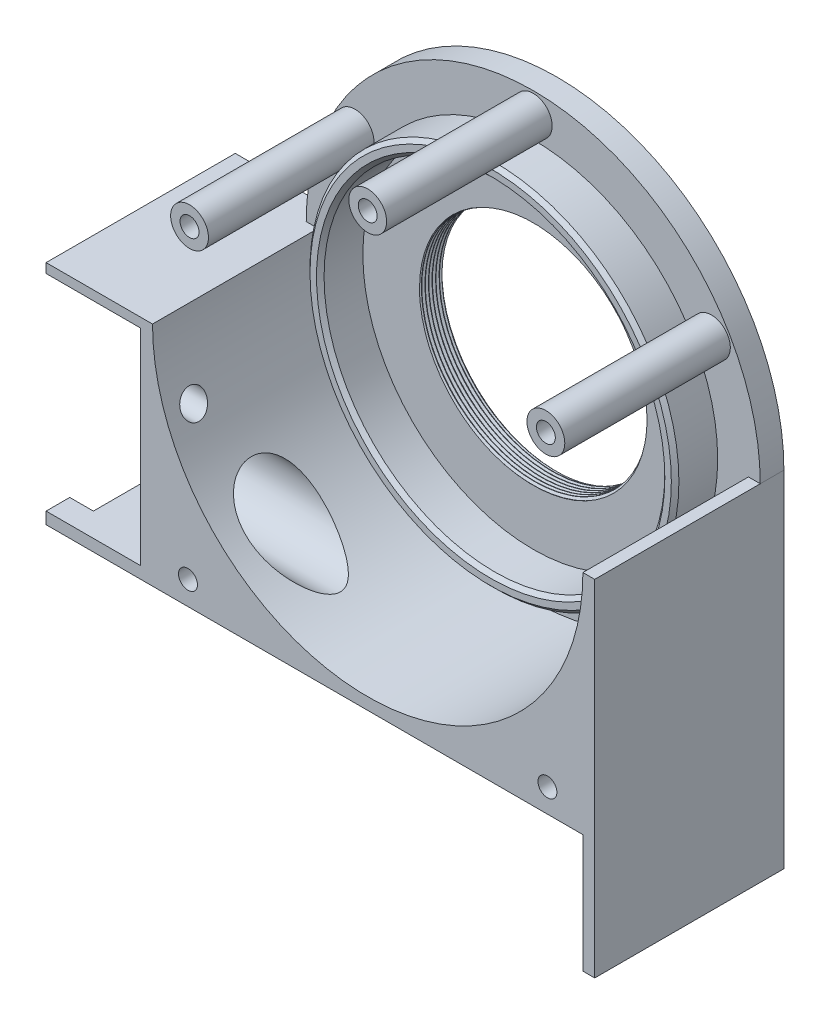
from build123d import *

# Parameters (mm, degrees)
ESQUISSE1_R                           = 48
ESQUISSE1_R_2                         = 23.8
BOSS_EXTRU_1_DEPTH                    = 40
ESQUISSE2_R                           = 45.5
ENL_V_MAT_EXTRU_1_DEPTH               = 35
CHANFREIN2_SIZE                       = 0.5
ENL_VEMENT_DE_MATI_RE_BALAYAGE1_PITCH = 0.75
ENL_V_MAT_EXTRU_6_DEPTH               = 35
ESQUISSE27_R                          = 7.675
ENL_V_MAT_EXTRU_7_DEPTH               = 79.790862536
BOSS_EXTRU_5_REACH                    = 116.543
BOSS_EXTRU_5_END_RADIUS               = 48
ESQUISSE33_W                          = 40
ESQUISSE33_H                          = 48
ESQUISSE33_R                          = 7.675
ESQUISSE33_R_2                        = 2.75
ESQUISSE35_R                          = 2.75
ENL_V_MAT_EXTRU_12_DEPTH              = 16
BOSS_EXTRU_6_DEPTH                    = 20
ESQUISSE37_W                          = 68
ESQUISSE37_H                          = 2.5
BOSS_EXTRU_7_DEPTH                    = 25
BOSS_EXTRU_10_REACH                   = 109.485
BOSS_EXTRU_11_DEPTH                   = 25
ESQUISSE46_R                          = 2
ENL_V_MAT_EXTRU_14_DEPTH              = 5
ESQUISSE47_R                          = 39
ESQUISSE47_R_2                        = 36.025
BOSS_EXTRU_12_DEPTH                   = 9
ESQUISSE48_W                          = 10
ESQUISSE48_H                          = 27.5
ENL_V_MAT_EXTRU_15_DEPTH              = 9
CHANFREIN3_SIZE                       = 0.8
ESQUISSE49_R                          = 4
ESQUISSE49_R_2                        = 2
BOSS_EXTRU_13_DEPTH                   = 35
ESQUISSE50_W                          = 37.5
ESQUISSE50_H                          = 2
BOSS_EXTRU_14_DEPTH                   = 20


with BuildPart() as part:
    # Esquisse1 → Boss.-Extru.1 (new body)
    with BuildSketch(Plane.XY):
        Circle(ESQUISSE1_R)
        Circle(ESQUISSE1_R_2, mode=Mode.SUBTRACT)
    extrude(amount=BOSS_EXTRU_1_DEPTH)

    # Esquisse2 → Enlèv. mat.-Extru.1 (cut)
    with BuildSketch(Plane.XY.offset(40)):
        Circle(ESQUISSE2_R)
    extrude(amount=-ENL_V_MAT_EXTRU_1_DEPTH, mode=Mode.SUBTRACT)

    # Chanfrein2
    chanfrein2_edges = [part.edges().sort_by_distance(p)[0] for p in [
        (-23.8, 0, 0),
    ]]
    chamfer(chanfrein2_edges, length=CHANFREIN2_SIZE)

    # Enlèvement de matière-Balayage1: arcs per turn and ends read off the stored shape
    # Enlèvement de matière-Balayage1: the profile of Esquisse15 profile screwed along a left-hand helix through 10 turns, 8 arcs to a turn; built about Z, then put on its axis
    enl_vement_de_mati_re_balayage1_z = Axis((0, 0, 0), (0, 0, 1))
    enl_vement_de_mati_re_balayage1_corners = [(23.7997, 1.2461e-05, 0.644965711), (23.7997, 1.2461e-05, -0.017880699), (24.297964607, 1.2722e-05, 0.269792506), (24.297964607, 1.2722e-05, 0.357292506)]
    with BuildLine(mode=Mode.PRIVATE) as enl_vement_de_mati_re_balayage1_profile:
        Line(enl_vement_de_mati_re_balayage1_corners[0], enl_vement_de_mati_re_balayage1_corners[1])
        Line(enl_vement_de_mati_re_balayage1_corners[1], enl_vement_de_mati_re_balayage1_corners[2])
        Line(enl_vement_de_mati_re_balayage1_corners[2], enl_vement_de_mati_re_balayage1_corners[3])
        Line(enl_vement_de_mati_re_balayage1_corners[3], enl_vement_de_mati_re_balayage1_corners[0])
    enl_vement_de_mati_re_balayage1_cap = Face(enl_vement_de_mati_re_balayage1_profile.wire())
    enl_vement_de_mati_re_balayage1_turn_angles = [0, -22.5, -45, -67.5, -90, -112.5, -135, -157.5, -180, -202.5, -225, -247.5, -270, -292.5, -315, -337.5, -360]
    enl_vement_de_mati_re_balayage1_turn_weights = [1, 0.9238795325112867, 1, 0.9238795325112867, 1, 0.9238795325112867, 1, 0.9238795325112867, 1, 0.9238795325112867, 1, 0.9238795325112867, 1, 0.9238795325112867, 1, 0.9238795325112867, 1]
    enl_vement_de_mati_re_balayage1_turn_rails = [Edge.make_bspline([Vector(p[0], p[1], 0).rotate(enl_vement_de_mati_re_balayage1_z, enl_vement_de_mati_re_balayage1_turn_angles[k]) / enl_vement_de_mati_re_balayage1_turn_weights[k] + Vector(0, 0, p[2] + -ENL_VEMENT_DE_MATI_RE_BALAYAGE1_PITCH * enl_vement_de_mati_re_balayage1_turn_angles[k] / 360) for k in range(17)], [0, 0, 0, 1, 1, 2, 2, 3, 3, 4, 4, 5, 5, 6, 6, 7, 7, 8, 8, 8], 2, enl_vement_de_mati_re_balayage1_turn_weights) for p in enl_vement_de_mati_re_balayage1_corners]
    enl_vement_de_mati_re_balayage1_turn_sides = [Face.make_surface_from_curves(enl_vement_de_mati_re_balayage1_turn_rails[p[0]], enl_vement_de_mati_re_balayage1_turn_rails[p[1]]) for p in [(0, 1), (1, 2), (2, 3), (3, 0)]]
    enl_vement_de_mati_re_balayage1 = Plane(origin=(0, 0, 0), x_dir=(1, 0, 0), z_dir=(0, 0, 1)) * Solid(Shell([*[p.moved(Location((0, 0, ENL_VEMENT_DE_MATI_RE_BALAYAGE1_PITCH * i))) for i in range(10) for p in enl_vement_de_mati_re_balayage1_turn_sides], enl_vement_de_mati_re_balayage1_cap, enl_vement_de_mati_re_balayage1_cap.rotate(enl_vement_de_mati_re_balayage1_z, -3600).moved(Location((0, 0, -ENL_VEMENT_DE_MATI_RE_BALAYAGE1_PITCH * -3600 / 360)))]))
    add(enl_vement_de_mati_re_balayage1, mode=Mode.SUBTRACT)

    # Esquisse23 → Enlèv. mat.-Extru.6 (cut)
    with BuildSketch(Plane.XY.offset(40)):
        with BuildLine():
            Line((-43.941981962, 0), (-49.525958016, 0))
            ThreePointArc((-49.525958016, 0), (0, 49.525958016), (49.525958016, 0))
            Line((49.525958016, 0), (43.941981962, 0))
            ThreePointArc((43.941981962, 0), (0, 43.941981962), (-43.941981962, 0))
        make_face()
    extrude(amount=-ENL_V_MAT_EXTRU_6_DEPTH, mode=Mode.SUBTRACT)

    # Esquisse27 → Enlèv. mat.-Extru.7 (cut, through all)
    with BuildSketch(Plane(origin=(0, 0, 0), x_dir=(0, 0, -1), z_dir=(1, 0, 0))):
        with Locations((-27.5, -34)):
            Circle(ESQUISSE27_R)
    extrude(amount=-ENL_V_MAT_EXTRU_7_DEPTH, mode=Mode.SUBTRACT)

    # Boss.-Extru.5: up to this cylinder (the profile starts outside it)
    boss_extru_5_end = Plane(origin=(0, 0, 19.125585), z_dir=(0, 0, -1)) * Cylinder(BOSS_EXTRU_5_END_RADIUS, 330.086, mode=Mode.PRIVATE)
    # Esquisse33 → Boss.-Extru.5 (add, up to the surface)
    with BuildSketch(Plane(origin=(-48, 0, 0), x_dir=(0, 0, -1), z_dir=(1, 0, 0)), mode=Mode.PRIVATE) as boss_extru_5_sk1:
        with Locations((-20, -24)):
            Rectangle(ESQUISSE33_W, ESQUISSE33_H)
        with Locations((-27.5, -34)):
            Circle(ESQUISSE33_R, mode=Mode.SUBTRACT)
        with Locations(Location((-34.217514421, -15.96877708, 0), (0, 0, 180))):
            Circle(ESQUISSE33_R_2, mode=Mode.SUBTRACT)
        with Locations(Location((-9.46877708, -40.717514421, 0), (0, 0, 180))):
            Circle(ESQUISSE33_R_2, mode=Mode.SUBTRACT)
    boss_extru_5_tool1 = extrude(boss_extru_5_sk1.sketch, amount=BOSS_EXTRU_5_REACH, mode=Mode.PRIVATE) - boss_extru_5_end
    add(boss_extru_5_tool1.solids().sort_by_distance((-48, -22.781015, 19.125585))[0])

    # Esquisse35 → Enlèv. mat.-Extru.12 (cut)
    with BuildSketch(Plane.ZY.offset(48)):
        with Locations((34.217514421, -15.96877708)):
            Circle(ESQUISSE35_R)
        with Locations((9.46877708, -40.717514421)):
            Circle(ESQUISSE35_R)
    extrude(amount=-ENL_V_MAT_EXTRU_12_DEPTH, mode=Mode.SUBTRACT)

    # Esquisse36 → Boss.-Extru.6 (add)
    with BuildSketch(Plane.ZY.offset(48)):
        Polygon((2.5, 0), (0, 0), (0, -48), (40, -48), (40, -45.5), (2.5, -45.5), align=None)
    extrude(amount=BOSS_EXTRU_6_DEPTH)

    # Esquisse37 → Boss.-Extru.7 (add)
    with BuildSketch(Plane.XZ.offset(48)):
        with Locations((-34, 1.25)):
            Rectangle(ESQUISSE37_W, ESQUISSE37_H)
    extrude(amount=BOSS_EXTRU_7_DEPTH)

    # Boss.-Extru.10: up to this face of the body (flat: up to its plane)
    boss_extru_10_end = Plane(part.part.faces().sort_by_distance((-25.976215977, 0, 0))[0])
    # Esquisse43 → Boss.-Extru.10 (add, up to the picked face)
    with BuildSketch(Plane.XY.offset(40), mode=Mode.PRIVATE) as boss_extru_10_sk1:
        with BuildLine():
            Line((0, -45.5), (0, -48))
            Line((0, -48), (48, -48))
            Line((48, -48), (48, 0))
            Line((48, 0), (45.5, 0))
            ThreePointArc((45.5, 0), (32.173358544, -32.173358544), (0, -45.5))
        make_face()
    boss_extru_10_tool1 = split(extrude(boss_extru_10_sk1.sketch, amount=-BOSS_EXTRU_10_REACH, mode=Mode.PRIVATE), bisect_by=boss_extru_10_end, keep=Keep.BOTH, mode=Mode.PRIVATE)
    add(boss_extru_10_tool1.solids().sort_by(Axis((35.245089, -35.245089, 40), (0, 0, -1)))[0])

    # Esquisse45 → Boss.-Extru.11 (add)
    with BuildSketch(Plane.XZ.offset(48)):
        Polygon((0, 0), (48, 0), (48, 2.5), (48, 40), (45.5, 40), (45.5, 2.5), (0, 2.5), align=None)
    extrude(amount=BOSS_EXTRU_11_DEPTH)

    # Esquisse46 → Enlèv. mat.-Extru.14 (cut)
    with BuildSketch(Plane.XY.offset(40)):
        with Locations((-38, -43)):
            Circle(ESQUISSE46_R)
        with Locations((38, -43)):
            Circle(ESQUISSE46_R)
    extrude(amount=-ENL_V_MAT_EXTRU_14_DEPTH, mode=Mode.SUBTRACT)

    # Esquisse47 → Boss.-Extru.12 (add)
    with BuildSketch(Plane.XY.offset(5)):
        Circle(ESQUISSE47_R)
        Circle(ESQUISSE47_R_2, mode=Mode.SUBTRACT)
    extrude(amount=BOSS_EXTRU_12_DEPTH)

    # Esquisse48 → Enlèv. mat.-Extru.15 (cut)
    with BuildSketch(Plane.XZ.offset(48)):
        with Locations((-68, 21.25)):
            Rectangle(ESQUISSE48_W, ESQUISSE48_H)
    extrude(amount=-ENL_V_MAT_EXTRU_15_DEPTH, mode=Mode.SUBTRACT)

    # Chanfrein3
    chanfrein3_edges = [part.edges().sort_by_distance(p)[0] for p in [
        (-39, 0, 14),
        (-36.025, 0, 14),
    ]]
    chamfer(chanfrein3_edges, length=CHANFREIN3_SIZE)

    # Esquisse49 → Boss.-Extru.13 (add)
    # profile 1 of 3: a face of its own
    with BuildSketch(Plane.XY.offset(5)):
        with Locations((-37.672105065, 21.75)):
            Circle(ESQUISSE49_R)
        with Locations((-37.672105065, 21.75)):
            Circle(ESQUISSE49_R_2, mode=Mode.SUBTRACT)
    # profile 2 of 3: a face of its own
    with BuildSketch(Plane.XY.offset(5)):
        with Locations((0, 43.5)):
            Circle(ESQUISSE49_R)
        with Locations((0, 43.5)):
            Circle(ESQUISSE49_R_2, mode=Mode.SUBTRACT)
    # profile 3 of 3: a face of its own
    with BuildSketch(Plane.XY.offset(5)):
        with Locations((37.672105065, 21.75)):
            Circle(ESQUISSE49_R)
        with Locations((37.672105065, 21.75)):
            Circle(ESQUISSE49_R_2, mode=Mode.SUBTRACT)
    extrude(amount=BOSS_EXTRU_13_DEPTH)

    # Esquisse50 → Boss.-Extru.14 (add)
    with BuildSketch(Plane.ZY.offset(48)):
        with Locations((21.25, -1)):
            Rectangle(ESQUISSE50_W, ESQUISSE50_H)
    extrude(amount=BOSS_EXTRU_14_DEPTH)


solid = part.part
